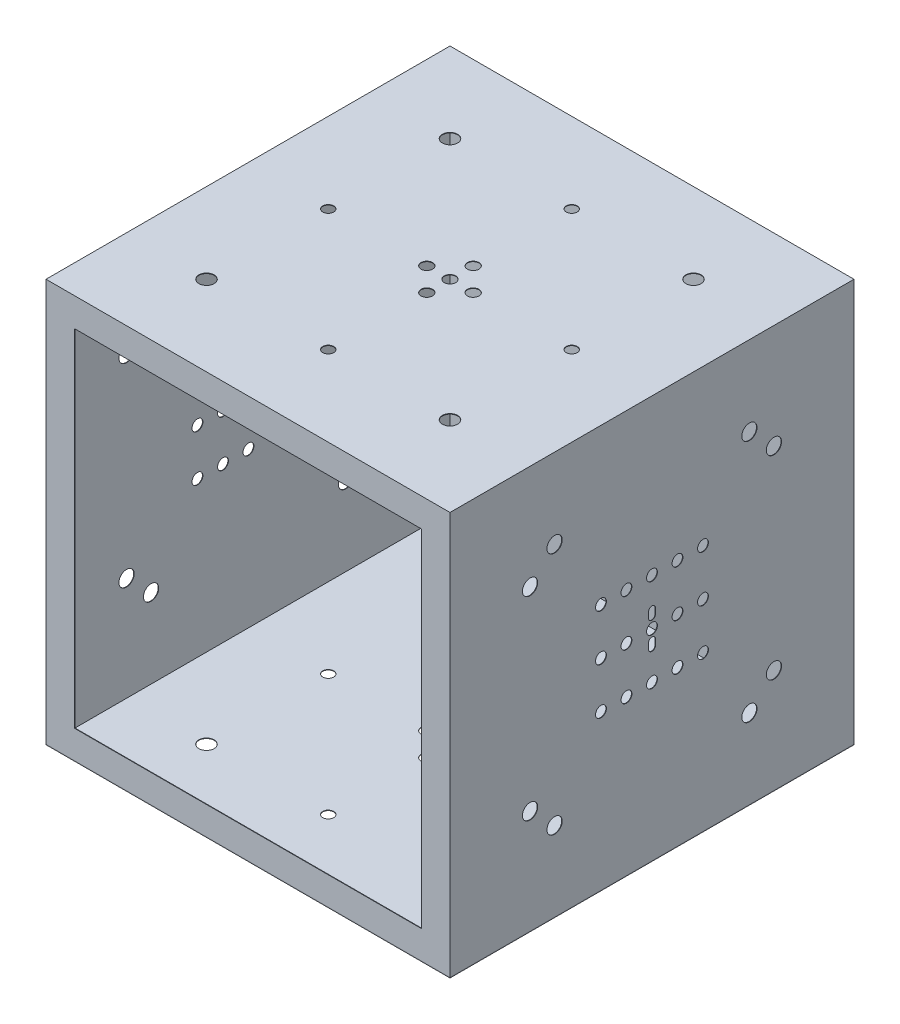
from build123d import *

# Parameters (mm, degrees)
SKETCH1_W           = 3484
SKETCH1_H           = 3477
BOSS_EXTRUDE1_DEPTH = 3484
SHELL1_T            = -4
SKETCH2_W           = 3484
SKETCH2_H           = 3477
SKETCH2_W_2         = 2991.00949094
SKETCH2_H_2         = 2985
BOSS_EXTRUDE2_DEPTH = 4
SKETCH3_R           = 49.85
SKETCH3_R_2         = 46.75
SKETCH3_R_3         = 65.8
CUT_EXTRUDE1_DEPTH  = 5222.335940159
SKETCH4_R           = 91.2
SKETCH4_R_2         = 35.635
SKETCH4_R_3         = 65.8
CUT_EXTRUDE2_DEPTH  = 4266.583459505
SKETCH5_R           = 46.75
SKETCH5_R_2         = 65.8
CUT_EXTRUDE3_DEPTH  = 5225.834375365


with BuildPart() as part:
    # Sketch1 → Boss-Extrude1 (new body)
    with BuildSketch(Plane.XY):
        Rectangle(SKETCH1_W, SKETCH1_H)
    extrude(amount=BOSS_EXTRUDE1_DEPTH)

    # Shell1
    shell1_openings = [part.faces().sort_by_distance(p)[0] for p in [
        (0, 0, 3484),
    ]]
    offset(amount=SHELL1_T, openings=shell1_openings, kind=Kind.INTERSECTION)

    # Sketch2 → Boss-Extrude2 (add)
    with BuildSketch(Plane.XY.offset(3484)):
        Rectangle(SKETCH2_W, SKETCH2_H)
        Rectangle(SKETCH2_W_2, SKETCH2_H_2, mode=Mode.SUBTRACT)
    extrude(amount=-BOSS_EXTRUDE2_DEPTH)

    # Sketch3 → Cut-Extrude1 (cut, through all)
    with BuildSketch(Plane(origin=(0, 1738.5, 0), x_dir=(1, 0, 0), z_dir=(0, 1, 0))):
        with Locations((0, -1742)):
            Circle(SKETCH3_R)
        with Locations((-200, -1742)):
            Circle(SKETCH3_R)
        with Locations((-1050, -1742)):
            Circle(SKETCH3_R_2)
        with Locations((-1050, -692)):
            Circle(SKETCH3_R_3)
        with Locations((1050, -692)):
            Circle(SKETCH3_R_3)
        with Locations((200, -1742)):
            Circle(SKETCH3_R)
        with Locations((1050, -1742)):
            Circle(SKETCH3_R_2)
        with Locations((0, -2792)):
            Circle(SKETCH3_R_2)
        with Locations((0, -1942)):
            Circle(SKETCH3_R)
        with Locations((0, -1542)):
            Circle(SKETCH3_R)
        with Locations((0, -692)):
            Circle(SKETCH3_R_2)
        with Locations((1050, -2792)):
            Circle(SKETCH3_R_3)
        with Locations((-1050, -2792)):
            Circle(SKETCH3_R_3)
    extrude(amount=-CUT_EXTRUDE1_DEPTH, mode=Mode.SUBTRACT)

    # Sketch4 → Cut-Extrude2 (cut, through all)
    with BuildSketch(Plane(origin=(0, 0, 0), x_dir=(-1, 0, 0), z_dir=(0, 0, -1))):
        Circle(SKETCH4_R)
        with Locations((0, 140)):
            Circle(SKETCH4_R_2)
        with Locations((-222, 382)):
            Circle(SKETCH4_R)
        with Locations((-900, 898.191733639)):
            Circle(SKETCH4_R_3)
        with Locations((222, -382)):
            Circle(SKETCH4_R)
        with Locations((0, -140)):
            Circle(SKETCH4_R_2)
        with Locations((-900, -898.191733639)):
            Circle(SKETCH4_R_3)
        with Locations((900, -898.191733639)):
            Circle(SKETCH4_R_3)
        with Locations((900, 898.191733639)):
            Circle(SKETCH4_R_3)
    extrude(amount=-CUT_EXTRUDE2_DEPTH, mode=Mode.SUBTRACT)

    # Sketch5 → Cut-Extrude3 (cut, through all)
    with BuildSketch(Plane.ZY.offset(1742)):
        with Locations((1742, 0)):
            Circle(SKETCH5_R)
        with Locations((1522, 0)):
            Circle(SKETCH5_R)
        with Locations((1302, 0)):
            Circle(SKETCH5_R)
        with Locations((1742, 400)):
            Circle(SKETCH5_R)
        with Locations((1522, 400)):
            Circle(SKETCH5_R)
        with Locations((1302, 400)):
            Circle(SKETCH5_R)
        with Locations((902, 1050)):
            Circle(SKETCH5_R_2)
        with Locations((690.312712863, 837.886537709)):
            Circle(SKETCH5_R_2)
        with Locations((2582, 1050)):
            Circle(SKETCH5_R_2)
        with Locations((2793.687287137, 837.886537709)):
            Circle(SKETCH5_R_2)
        with Locations((2182, 0)):
            Circle(SKETCH5_R)
        with Locations((1962, 0)):
            Circle(SKETCH5_R)
        with Locations((1962, 400)):
            Circle(SKETCH5_R)
        with Locations((2182, 400)):
            Circle(SKETCH5_R)
        with Locations((2582, -1050)):
            Circle(SKETCH5_R_2)
        with Locations((2793.687287137, -837.886537709)):
            Circle(SKETCH5_R_2)
        with Locations((2182, -400)):
            Circle(SKETCH5_R)
        with Locations((1962, -400)):
            Circle(SKETCH5_R)
        with Locations((1742, -400)):
            Circle(SKETCH5_R)
        with Locations((1522, -400)):
            Circle(SKETCH5_R)
        with Locations((1302, -400)):
            Circle(SKETCH5_R)
        with Locations((902, -1050)):
            Circle(SKETCH5_R_2)
        with Locations((690.312712863, -837.886537709)):
            Circle(SKETCH5_R_2)
        with BuildLine():
            Line((1712, 92.5), (1712, 140))
            ThreePointArc((1712, 140), (1742, 170), (1772, 140))
            Line((1772, 140), (1772, 92.5))
            ThreePointArc((1772, 92.5), (1742, 62.5), (1712, 92.5))
        make_face()
        with BuildLine():
            Line((1712, -92.5), (1712, -140))
            ThreePointArc((1712, -140), (1742, -170), (1772, -140))
            Line((1772, -140), (1772, -92.5))
            ThreePointArc((1772, -92.5), (1742, -62.5), (1712, -92.5))
        make_face()
    extrude(amount=-CUT_EXTRUDE3_DEPTH, mode=Mode.SUBTRACT)


with BuildPart() as body_2:
    # Split1: the piece on the far side of the plane
    add(part.part)
    split(bisect_by=Plane(origin=(-1742, -1734.5, 3484), x_dir=(0, 0, 1), z_dir=(0, 1, 0)), keep=Keep.BOTTOM)


with BuildPart() as part_1:
    add(part.part)

    # Split1
    split(bisect_by=Plane(origin=(-1742, -1734.5, 3484), x_dir=(0, 0, 1), z_dir=(0, 1, 0)), keep=Keep.TOP)


solid = Compound([body_2.part, part_1.part])
